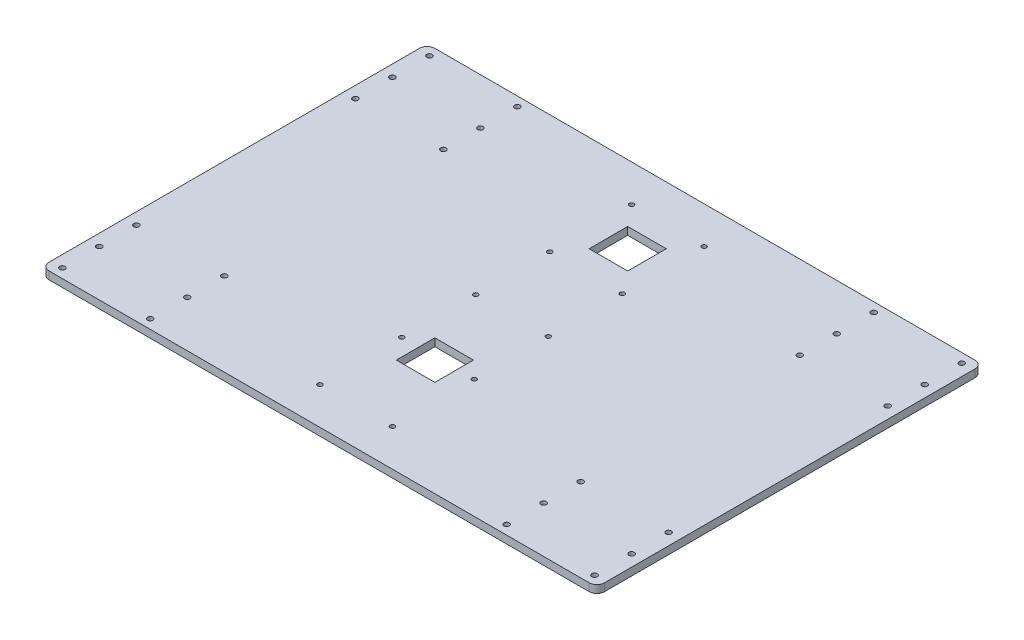
from build123d import *

# Parameters (mm, degrees)
SKETCH2_W           = 360
SKETCH2_H           = 250
SKETCH2_R           = 1.75
SKETCH2_R_2         = 1.5
SKETCH2_W_2         = 25
SKETCH2_H_2         = 25
BOSS_EXTRUDE1_DEPTH = 5
FILLET1_R           = 5


with BuildPart() as part:
    # Sketch2 → Boss-Extrude1 (new body)
    with BuildSketch(Plane(origin=(0, 0, 0), x_dir=(1, 0, 0), z_dir=(0, 1, 0))):
        Rectangle(SKETCH2_W, SKETCH2_H)
        with Locations((-172.5, 95)):
            Circle(SKETCH2_R, mode=Mode.SUBTRACT)
        with Locations((-172.5, 119)):
            Circle(SKETCH2_R, mode=Mode.SUBTRACT)
        with Locations((-172.5, 71)):
            Circle(SKETCH2_R, mode=Mode.SUBTRACT)
        with Locations((-115.5, 119)):
            Circle(SKETCH2_R, mode=Mode.SUBTRACT)
        with Locations((-115.5, 95)):
            Circle(SKETCH2_R, mode=Mode.SUBTRACT)
        with Locations((-115.5, 71)):
            Circle(SKETCH2_R, mode=Mode.SUBTRACT)
        with Locations((172.5, 71)):
            Circle(SKETCH2_R, mode=Mode.SUBTRACT)
        with Locations((172.5, 95)):
            Circle(SKETCH2_R, mode=Mode.SUBTRACT)
        with Locations((172.5, 119)):
            Circle(SKETCH2_R, mode=Mode.SUBTRACT)
        with Locations((115.5, 119)):
            Circle(SKETCH2_R, mode=Mode.SUBTRACT)
        with Locations((115.5, 95)):
            Circle(SKETCH2_R, mode=Mode.SUBTRACT)
        with Locations((115.5, 71)):
            Circle(SKETCH2_R, mode=Mode.SUBTRACT)
        with Locations((-172.5, -119)):
            Circle(SKETCH2_R, mode=Mode.SUBTRACT)
        with Locations((-172.5, -95)):
            Circle(SKETCH2_R, mode=Mode.SUBTRACT)
        with Locations((-172.5, -71)):
            Circle(SKETCH2_R, mode=Mode.SUBTRACT)
        with Locations((-115.5, -119)):
            Circle(SKETCH2_R, mode=Mode.SUBTRACT)
        with Locations((-115.5, -95)):
            Circle(SKETCH2_R, mode=Mode.SUBTRACT)
        with Locations((-115.5, -71)):
            Circle(SKETCH2_R, mode=Mode.SUBTRACT)
        with Locations((115.5, -71)):
            Circle(SKETCH2_R, mode=Mode.SUBTRACT)
        with Locations((115.5, -95)):
            Circle(SKETCH2_R, mode=Mode.SUBTRACT)
        with Locations((115.5, -119)):
            Circle(SKETCH2_R, mode=Mode.SUBTRACT)
        with Locations((172.5, -119)):
            Circle(SKETCH2_R, mode=Mode.SUBTRACT)
        with Locations((172.5, -95)):
            Circle(SKETCH2_R, mode=Mode.SUBTRACT)
        with Locations((172.5, -71)):
            Circle(SKETCH2_R, mode=Mode.SUBTRACT)
        with Locations((-23.5, 101)):
            Circle(SKETCH2_R_2, mode=Mode.SUBTRACT)
        with Locations((-23.5, -101)):
            Circle(SKETCH2_R_2, mode=Mode.SUBTRACT)
        with Locations((-23.5, 0)):
            Circle(SKETCH2_R_2, mode=Mode.SUBTRACT)
        with Locations((-23.5, 48)):
            Circle(SKETCH2_R_2, mode=Mode.SUBTRACT)
        with Locations((-23.5, -48)):
            Circle(SKETCH2_R_2, mode=Mode.SUBTRACT)
        with Locations((23.5, 101)):
            Circle(SKETCH2_R_2, mode=Mode.SUBTRACT)
        with Locations((23.5, 48)):
            Circle(SKETCH2_R_2, mode=Mode.SUBTRACT)
        with Locations((23.5, 0)):
            Circle(SKETCH2_R_2, mode=Mode.SUBTRACT)
        with Locations((23.5, -48)):
            Circle(SKETCH2_R_2, mode=Mode.SUBTRACT)
        with Locations((23.5, -101)):
            Circle(SKETCH2_R_2, mode=Mode.SUBTRACT)
        with Locations((0, 75)):
            Rectangle(SKETCH2_W_2, SKETCH2_H_2, mode=Mode.SUBTRACT)
        with Locations((0, -50)):
            Rectangle(SKETCH2_W_2, SKETCH2_H_2, mode=Mode.SUBTRACT)
    extrude(amount=BOSS_EXTRUDE1_DEPTH)

    # Fillet1
    fillet1_edges = [part.edges().sort_by_distance(p)[0] for p in [
        (-180, 2.5, -125),
        (180, 2.5, -125),
        (180, 2.5, 125),
        (-180, 2.5, 125),
    ]]
    fillet(fillet1_edges, radius=FILLET1_R)


solid = part.part
